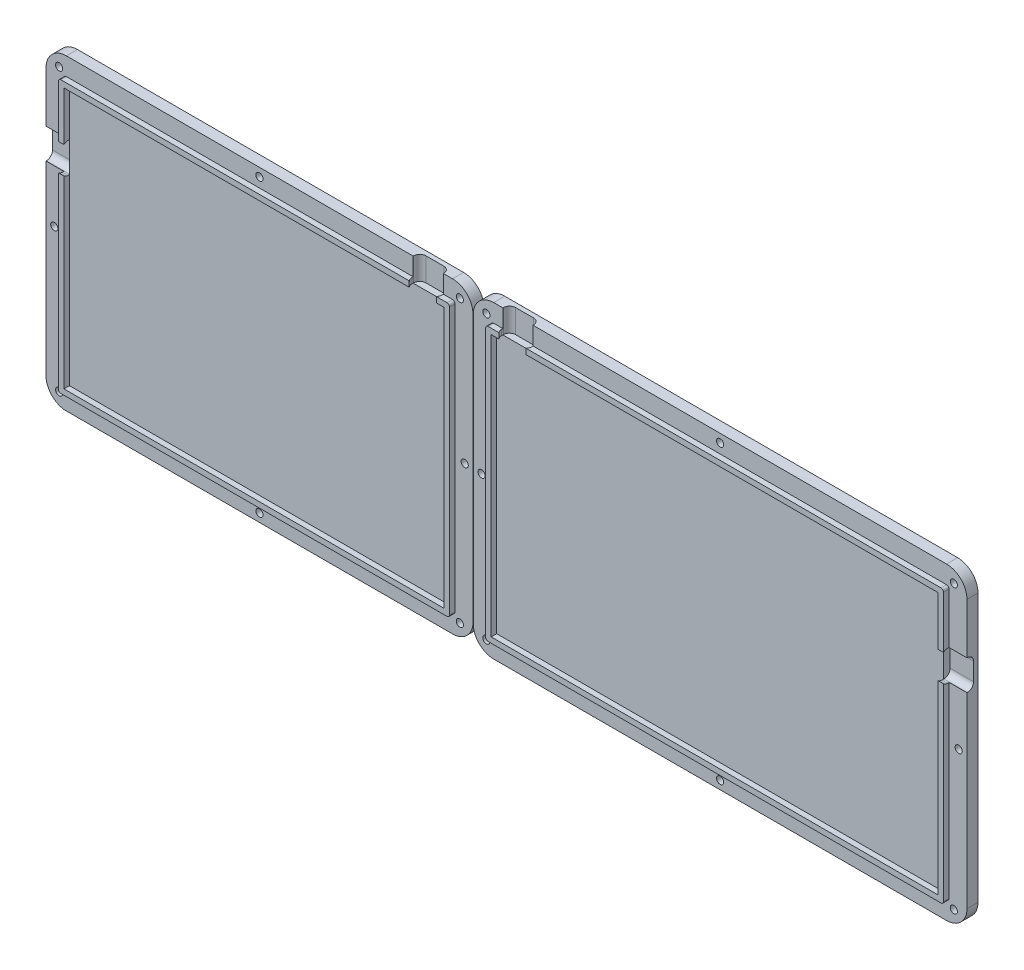
from build123d import *

# Parameters (mm, degrees)
BOSS_EXTRUDE1_DEPTH            = 2
BOSS_EXTRUDE1_2_DEPTH          = 2
BOSS_EXTRUDE2_DEPTH            = 4
BOSS_EXTRUDE2_2_DEPTH          = 4
CUT_EXTRUDE1_DEPTH             = 8.5
CUT_EXTRUDE2_START             = -6.99525
CUT_EXTRUDE2_DEPTH             = 8.5
CUT_EXTRUDE3_START             = -7
CUT_EXTRUDE3_DEPTH             = 8.5
SKETCH7_R                      = 6
SKETCH7_R_2                    = 5.999999998
CUT_EXTRUDE4_DEPTH             = 1
CBORE_FOR_M2_SHCS1_AT_2_COUNT  = 2
CBORE_FOR_M2_SHCS1_AT_2_PITCH  = 169.33925
CBORE_FOR_M2_SHCS1_AT_3_COUNT  = 2
CBORE_FOR_M2_SHCS1_AT_3_PITCH  = 197.865862853
CBORE_FOR_M2_SHCS1_AT_4_COUNT  = 2
CBORE_FOR_M2_SHCS1_AT_4_PITCH  = 102.347999613
CBORE_FOR_M2_SHCS1_AT_5_COUNT  = 2
CBORE_FOR_M2_SHCS1_AT_5_PITCH  = 205.937809117
CBORE_FOR_M2_SHCS1_AT_6_COUNT  = 2
CBORE_FOR_M2_SHCS1_AT_6_PITCH  = 178.95
CBORE_FOR_M2_SHCS1_AT_7_COUNT  = 2
CBORE_FOR_M2_SHCS1_AT_7_PITCH  = 324.12
CBORE_FOR_M2_SHCS1_AT_8_COUNT  = 2
CBORE_FOR_M2_SHCS1_AT_8_PITCH  = 339.76617419
CBORE_FOR_M2_SHCS1_AT_9_COUNT  = 2
CBORE_FOR_M2_SHCS1_AT_9_PITCH  = 84.687729438
CBORE_FOR_M2_SHCS1_AT_10_COUNT = 2
CBORE_FOR_M2_SHCS1_AT_10_PITCH = 178.578567038
CBORE_FOR_M2_SHCS1_AT_11_COUNT = 2
CBORE_FOR_M2_SHCS1_AT_11_PITCH = 272.060490423
CBORE_FOR_M2_SHCS1_AT_12_COUNT = 2
CBORE_FOR_M2_SHCS1_AT_12_PITCH = 251.541084119
CBORE_FOR_M2_SHCS1_AT_13_COUNT = 2
CBORE_FOR_M2_SHCS1_AT_13_PITCH = 329.830375377
CBORE_FOR_M2_SHCS1_AT_14_COUNT = 2
CBORE_FOR_M2_SHCS1_AT_14_PITCH = 51.203914572
CBORE_FOR_M2_SHCS1_AT_15_COUNT = 2
CBORE_FOR_M2_SHCS1_AT_15_PITCH = 134.183962365
CBORE_FOR_M2_SHCS1_AT_16_COUNT = 2
CBORE_FOR_M2_SHCS1_AT_16_PITCH = 184.381831212


# Read off the part's stored shape, not the designer's step: Cut-Extrude2, Cut-Extrude3
with BuildPart() as part:
    # Sketch2 → Boss-Extrude1 (new body)
    with BuildSketch(Plane(origin=(0, 0, 0), x_dir=(-1, 0, 0), z_dir=(0, 0, -1))):
        with BuildLine():
            Line((-127.28, 95.544999648), (-127.28, -1.072999648))
            ThreePointArc((-127.28, -1.072999648), (-127.016396, -1.709396), (-126.379999648, -1.973))
            Line((-126.379999648, -1.973), (13.489999648, -1.973))
            ThreePointArc((13.489999648, -1.973), (14.126396, -1.709396), (14.39, -1.072999648))
            Line((14.39, -1.072999648), (14.39, 65.764999333))
            Line((14.39, 65.764999333), (14.39, 77.705000667))
            Line((14.39, 77.705000667), (14.39, 95.544999648))
            ThreePointArc((14.39, 95.544999648), (14.126396, 96.181396), (13.489999648, 96.445))
            Line((13.489999648, 96.445), (-111.589999333, 96.445))
            Line((-111.589999333, 96.445), (-123.590000667, 96.445))
            Line((-123.590000667, 96.445), (-126.379999648, 96.445))
            ThreePointArc((-126.379999648, 96.445), (-127.016396, 96.181396), (-127.28, 95.544999648))
        make_face()
        Polygon((-125.28, 94.445), (-125.28, 0.027), (12.39, 0.027), (12.39, 65.764999333), (12.39, 77.705000667), (12.39, 94.445), (-111.589999333, 94.445), (-123.590000667, 94.445), align=None, mode=Mode.SUBTRACT)
    extrude(amount=BOSS_EXTRUDE1_DEPTH)


with BuildPart() as body_2:
    # Sketch2 → Boss-Extrude1 2 (new body)
    with BuildSketch(Plane(origin=(0, 0, 0), x_dir=(-1, 0, 0), z_dir=(0, 0, -1))):
        with BuildLine():
            Line((-156.080000667, 96.445), (-305.330002531, 96.445))
            ThreePointArc((-305.330002531, 96.445), (-305.966396812, 96.181397188), (-306.23, 95.545003062))
            Line((-306.23, 95.545003062), (-306.23, 77.705000667))
            Line((-306.23, 77.705000667), (-306.23, 65.764999333))
            Line((-306.23, 65.764999333), (-306.23, -1.503002531))
            ThreePointArc((-306.23, -1.503002531), (-305.966397047, -2.139396422), (-305.330003194, -2.402999469))
            Line((-305.330003194, -2.402999469), (-141.290563258, -2.403023469))
            ThreePointArc((-141.290563258, -2.403023469), (-140.654299585, -2.139474508), (-140.390750531, -1.503210874))
            Line((-140.390750531, -1.503210874), (-140.390750531, 95.545003062))
            ThreePointArc((-140.390750531, 95.545003062), (-140.654353531, 96.181397), (-141.290747469, 96.445))
            Line((-141.290747469, 96.445), (-144.079999333, 96.445))
            Line((-144.079999333, 96.445), (-156.080000667, 96.445))
        make_face()
        Polygon((-156.080000667, 94.445), (-304.23, 94.445), (-304.23, 77.705000667), (-304.23, 65.764999333), (-304.23, -0.40299963), (-142.390750531, -0.403023308), (-142.390750531, 94.445), (-144.079999333, 94.445), align=None, mode=Mode.SUBTRACT)
    extrude(amount=BOSS_EXTRUDE1_2_DEPTH)


with BuildPart() as body_3:
    # Sketch3 → Boss-Extrude2 (new body)
    with BuildSketch(Plane(origin=(0, 0, -2), x_dir=(-1, 0, 0), z_dir=(0, 0, -1))):
        with BuildLine():
            Line((-141.290751305, 102.945), (-144.079999333, 102.945))
            Line((-144.079999333, 102.945), (-305.330002531, 102.945))
            ThreePointArc((-305.330002531, 102.945), (-310.562592434, 100.777589721), (-312.73, 95.544998695))
            Line((-312.73, 95.544998695), (-312.73, -1.503002531))
            ThreePointArc((-312.73, -1.503002531), (-310.562589913, -6.735592243), (-305.329999236, -8.903))
            Line((-305.329999236, -8.903), (-141.291035381, -8.903023979))
            ThreePointArc((-141.291035381, -8.903023979), (-136.05806597, -6.735630109), (-133.890750032, -1.502628421))
            Line((-133.890750032, -1.502628421), (-133.89075, 95.544998695))
            ThreePointArc((-133.89075, 95.544998695), (-136.058158922, 100.777591078), (-141.290751305, 102.945))
        make_face()
    extrude(amount=BOSS_EXTRUDE2_DEPTH)


with BuildPart() as body_4:
    # Sketch3 → Boss-Extrude2 2 (new body)
    with BuildSketch(Plane(origin=(0, 0, -2), x_dir=(-1, 0, 0), z_dir=(0, 0, -1))):
        with BuildLine():
            Line((-133.78, 95.545000824), (-133.78, -1.073000824))
            ThreePointArc((-133.78, -1.073000824), (-131.612590078, -6.305590078), (-126.380000824, -8.473))
            Line((-126.380000824, -8.473), (13.490009317, -8.473))
            ThreePointArc((13.490009317, -8.473), (18.722593496, -6.305586659), (20.89, -1.072999648))
            Line((20.89, -1.072999648), (20.89, 95.545009317))
            ThreePointArc((20.89, 95.545009317), (18.722587075, 100.77759308), (13.490000824, 102.945))
            Line((13.490000824, 102.945), (-123.590000667, 102.945))
            Line((-123.590000667, 102.945), (-126.380009317, 102.945))
            ThreePointArc((-126.380009317, 102.945), (-131.61259308, 100.777587075), (-133.78, 95.545000824))
        make_face()
    extrude(amount=BOSS_EXTRUDE2_2_DEPTH)


with BuildPart() as cut_extrude1_tool:
    # Sketch4 → Cut-Extrude1 (new body)
    with BuildSketch(Plane(origin=(312.73, 0, 0), x_dir=(0, 0, -1), z_dir=(1, 0, 0))):
        with BuildLine():
            Line((1.485, 66.265), (2, 66.265))
            Line((2, 66.265), (2, 77.205))
            Line((2, 77.205), (1.485, 77.205))
            ThreePointArc((1.485, 77.205), (-0.105990258, 76.545990258), (-0.765, 74.955))
            Line((-0.765, 74.955), (-0.765, 73.003244897))
            Line((-0.765, 73.003244897), (-0.765, 71.023244897))
            Line((-0.765, 71.023244897), (-0.765, 68.515))
            ThreePointArc((-0.765, 68.515), (-0.105990258, 66.924009742), (1.485, 66.265))
        make_face()
        with BuildLine():
            ThreePointArc((2.145, 66.265), (3.735990258, 66.924009742), (4.395, 68.515))
            Line((4.395, 68.515), (4.395, 74.955))
            ThreePointArc((4.395, 74.955), (3.735990258, 76.545990258), (2.145, 77.205))
            Line((2.145, 77.205), (2, 77.205))
            Line((2, 77.205), (2, 66.265))
            Line((2, 66.265), (2.145, 66.265))
        make_face()
    extrude(amount=-CUT_EXTRUDE1_DEPTH)


with BuildPart() as body_2_1:
    add(body_2.part)

    # Cut-Extrude1: cut by cut_extrude1_tool
    add(cut_extrude1_tool.part, mode=Mode.SUBTRACT)


with BuildPart() as body_3_1:
    add(body_3.part)

    # Cut-Extrude1: cut by cut_extrude1_tool
    add(cut_extrude1_tool.part, mode=Mode.SUBTRACT)


with BuildPart() as cut_extrude2_tool:
    # Cut-Extrude2 outline → Cut-Extrude2 (new body)
    with BuildSketch(Plane.ZY.offset(19.38525).offset(CUT_EXTRUDE2_START)):
        with BuildLine():
            ThreePointArc((0, 76.645347597), (-0.691520981, 77.060443195), (-1.485, 77.205))
            Line((-1.485, 77.205), (-2.145, 77.205))
            ThreePointArc((-2.145, 77.205), (-3.735990258, 76.545990258), (-4.395, 74.955))
            Line((-4.395, 74.955), (-4.395, 68.515))
            ThreePointArc((-4.395, 68.515), (-3.735990258, 66.924009742), (-2.145, 66.265))
            Line((-2.145, 66.265), (-1.485, 66.265))
            ThreePointArc((-1.485, 66.265), (-0.691520981, 66.409556805), (0, 66.824652403))
            Line((0, 66.824652403), (0, 76.645347597))
        make_face()
    extrude(amount=CUT_EXTRUDE2_DEPTH)


with BuildPart() as part_1:
    add(part.part)

    # Cut-Extrude2: cut by cut_extrude2_tool
    add(cut_extrude2_tool.part, mode=Mode.SUBTRACT)


with BuildPart() as body_4_1:
    add(body_4.part)

    # Cut-Extrude2: cut by cut_extrude2_tool
    add(cut_extrude2_tool.part, mode=Mode.SUBTRACT)


with BuildPart() as cut_extrude3_tool:
    # Cut-Extrude3 outline → Cut-Extrude3 (new body)
    with BuildSketch(Plane(origin=(0, 101.445, 0), x_dir=(1, 0, 0), z_dir=(0, 1, 0)).offset(CUT_EXTRUDE3_START)):
        with BuildLine():
            Line((155.55, 1.485), (155.55, 2.145))
            ThreePointArc((155.55, 2.145), (154.890990258, 3.735990258), (153.3, 4.395))
            Line((153.3, 4.395), (146.86, 4.395))
            ThreePointArc((146.86, 4.395), (145.269009742, 3.735990258), (144.61, 2.145))
            Line((144.61, 2.145), (144.61, 1.485))
            ThreePointArc((144.61, 1.485), (144.754556805, 0.691520981), (145.169652403, 0))
            Line((145.169652403, 0), (154.990347597, 0))
            ThreePointArc((154.990347597, 0), (155.405443195, 0.691520981), (155.55, 1.485))
        make_face()
        with BuildLine():
            ThreePointArc((123.06, 2.145), (122.400990258, 3.735990258), (120.81, 4.395))
            Line((120.81, 4.395), (114.37, 4.395))
            ThreePointArc((114.37, 4.395), (112.779009742, 3.735990258), (112.12, 2.145))
            Line((112.12, 2.145), (112.12, 1.485))
            ThreePointArc((112.12, 1.485), (112.264556805, 0.691520981), (112.679652403, 0))
            Line((112.679652403, 0), (122.500347597, 0))
            ThreePointArc((122.500347597, 0), (122.915443195, 0.691520981), (123.06, 1.485))
            Line((123.06, 1.485), (123.06, 2.145))
        make_face()
    extrude(amount=CUT_EXTRUDE3_DEPTH)


with BuildPart() as part_2:
    add(part_1.part)

    # Cut-Extrude3: cut by cut_extrude3_tool
    add(cut_extrude3_tool.part, mode=Mode.SUBTRACT)


with BuildPart() as body_2_2:
    add(body_2_1.part)

    # Cut-Extrude3: cut by cut_extrude3_tool
    add(cut_extrude3_tool.part, mode=Mode.SUBTRACT)


with BuildPart() as body_3_2:
    add(body_3_1.part)

    # Cut-Extrude3: cut by cut_extrude3_tool
    add(cut_extrude3_tool.part, mode=Mode.SUBTRACT)


with BuildPart() as body_4_2:
    add(body_4_1.part)

    # Cut-Extrude3: cut by cut_extrude3_tool
    add(cut_extrude3_tool.part, mode=Mode.SUBTRACT)


with BuildPart() as cut_extrude4_tool:
    # Sketch7 → Cut-Extrude4 (new body)
    with BuildSketch(Plane(origin=(0, 0, -6), x_dir=(-1, 0, 0), z_dir=(0, 0, -1))):
        with Locations((8.89, 90.945)):
            Circle(SKETCH7_R)
        with Locations((8.89, 3.527)):
            Circle(SKETCH7_R)
        with Locations((-121.78, 90.945)):
            Circle(SKETCH7_R)
        with Locations((-121.78, 3.527)):
            Circle(SKETCH7_R)
        with Locations((-145.89075, 90.945)):
            Circle(SKETCH7_R_2)
        with Locations((-145.89075, 3.096976693)):
            Circle(SKETCH7_R)
        with Locations((-300.73, 90.945)):
            Circle(SKETCH7_R)
        with Locations((-300.73, 3.096999328)):
            Circle(SKETCH7_R)
        with Locations((-223.31039198, 90.945)):
            Circle(SKETCH7_R_2)
        with Locations((-223.310502246, 3.096988011)):
            Circle(SKETCH7_R_2)
        with Locations((-56.444995753, 90.945)):
            Circle(SKETCH7_R)
        with Locations((-56.444995753, 3.527)):
            Circle(SKETCH7_R)
    extrude(amount=-CUT_EXTRUDE4_DEPTH)


with BuildPart() as body_3_3:
    add(body_3_2.part)

    # Cut-Extrude4: cut by cut_extrude4_tool
    add(cut_extrude4_tool.part, mode=Mode.SUBTRACT)

    # Sketch9 → CBORE for M2 SHCS1 (revolve, cut)
    with BuildSketch(Plane(origin=(307.98, 98.195, -6), x_dir=(0, 1, 0), z_dir=(1, 0, 0))):
        Polygon((0, 0), (0, 8), (1.3, 7.218881195), (1.3, 2), (2.2, 2), (2.2, 0), align=None)
    cbore_for_m2_shcs1 = revolve(axis=Axis((307.98, 98.195, -12.35), (0, 0, 1)), mode=Mode.SUBTRACT)

    # CBORE for M2 SHCS1 at 2: CBORE for M2 SHCS1 ×2
    with Locations(*[(-i * CBORE_FOR_M2_SHCS1_AT_2_PITCH, 0, 0) for i in range(1, CBORE_FOR_M2_SHCS1_AT_2_COUNT)]):
        add(cbore_for_m2_shcs1, mode=Mode.SUBTRACT)

    # CBORE for M2 SHCS1 at 3: CBORE for M2 SHCS1 ×2
    with Locations(*[Vector(-0.8558285272557075, -0.5172596368704278, 0) * (i * CBORE_FOR_M2_SHCS1_AT_3_PITCH) for i in range(1, CBORE_FOR_M2_SHCS1_AT_3_COUNT)]):
        add(cbore_for_m2_shcs1, mode=Mode.SUBTRACT)

    # CBORE for M2 SHCS1 at 4: CBORE for M2 SHCS1 ×2
    with Locations(*[(0, -i * CBORE_FOR_M2_SHCS1_AT_4_PITCH, 0) for i in range(1, CBORE_FOR_M2_SHCS1_AT_4_COUNT)]):
        add(cbore_for_m2_shcs1, mode=Mode.SUBTRACT)

    # CBORE for M2 SHCS1 at 9: CBORE for M2 SHCS1 ×2
    with Locations(*[Vector(-0.9997864736420369, 0.020664150658107016, 0) * (i * CBORE_FOR_M2_SHCS1_AT_9_PITCH) for i in range(1, CBORE_FOR_M2_SHCS1_AT_9_COUNT)]):
        add(cbore_for_m2_shcs1, mode=Mode.SUBTRACT)

    # CBORE for M2 SHCS1 at 10: CBORE for M2 SHCS1 ×2
    with Locations(*[Vector(-0.9580615010974515, -0.28656266350468296, 0) * (i * CBORE_FOR_M2_SHCS1_AT_10_PITCH) for i in range(1, CBORE_FOR_M2_SHCS1_AT_10_COUNT)]):
        add(cbore_for_m2_shcs1, mode=Mode.SUBTRACT)

    # CBORE for M2 SHCS1 at 14: CBORE for M2 SHCS1 ×2
    with Locations(*[Vector(0.0341770744412766, -0.9994157931424915, 0) * (i * CBORE_FOR_M2_SHCS1_AT_14_PITCH) for i in range(1, CBORE_FOR_M2_SHCS1_AT_14_COUNT)]):
        add(cbore_for_m2_shcs1, mode=Mode.SUBTRACT)

    # CBORE for M2 SHCS1 at 15: CBORE for M2 SHCS1 ×2
    with Locations(*[Vector(-0.630996354561663, -0.7757857955195443, 0) * (i * CBORE_FOR_M2_SHCS1_AT_15_PITCH) for i in range(1, CBORE_FOR_M2_SHCS1_AT_15_COUNT)]):
        add(cbore_for_m2_shcs1, mode=Mode.SUBTRACT)

    # Combine2: union body 2
    add(body_2_2.part)


with BuildPart() as body_4_3:
    add(body_4_2.part)

    # Cut-Extrude4: cut by cut_extrude4_tool
    add(cut_extrude4_tool.part, mode=Mode.SUBTRACT)

    # CBORE for M2 SHCS1 at 5: CBORE for M2 SHCS1 ×2
    with Locations(*[Vector(-0.8689516547111612, -0.49489698097153, 0) * (i * CBORE_FOR_M2_SHCS1_AT_5_PITCH) for i in range(1, CBORE_FOR_M2_SHCS1_AT_5_COUNT)]):
        add(cbore_for_m2_shcs1, mode=Mode.SUBTRACT)

    # CBORE for M2 SHCS1 at 6: CBORE for M2 SHCS1 ×2
    with Locations(*[(-i * CBORE_FOR_M2_SHCS1_AT_6_PITCH, 0, 0) for i in range(1, CBORE_FOR_M2_SHCS1_AT_6_COUNT)]):
        add(cbore_for_m2_shcs1, mode=Mode.SUBTRACT)

    # CBORE for M2 SHCS1 at 7: CBORE for M2 SHCS1 ×2
    with Locations(*[(-i * CBORE_FOR_M2_SHCS1_AT_7_PITCH, 0, 0) for i in range(1, CBORE_FOR_M2_SHCS1_AT_7_COUNT)]):
        add(cbore_for_m2_shcs1, mode=Mode.SUBTRACT)

    # CBORE for M2 SHCS1 at 8: CBORE for M2 SHCS1 ×2
    with Locations(*[Vector(-0.9539501710913034, -0.29996511643001583, 0) * (i * CBORE_FOR_M2_SHCS1_AT_8_PITCH) for i in range(1, CBORE_FOR_M2_SHCS1_AT_8_COUNT)]):
        add(cbore_for_m2_shcs1, mode=Mode.SUBTRACT)

    # CBORE for M2 SHCS1 at 11: CBORE for M2 SHCS1 ×2
    with Locations(*[Vector(-0.9245554163680936, -0.3810476112829227, 0) * (i * CBORE_FOR_M2_SHCS1_AT_11_PITCH) for i in range(1, CBORE_FOR_M2_SHCS1_AT_11_COUNT)]):
        add(cbore_for_m2_shcs1, mode=Mode.SUBTRACT)

    # CBORE for M2 SHCS1 at 12: CBORE for M2 SHCS1 ×2
    with Locations(*[Vector(-0.9999757989894932, 0.006957114008331568, 0) * (i * CBORE_FOR_M2_SHCS1_AT_12_PITCH) for i in range(1, CBORE_FOR_M2_SHCS1_AT_12_COUNT)]):
        add(cbore_for_m2_shcs1, mode=Mode.SUBTRACT)

    # CBORE for M2 SHCS1 at 13: CBORE for M2 SHCS1 ×2
    with Locations(*[Vector(-0.9879926905698493, -0.15450062582575524, 0) * (i * CBORE_FOR_M2_SHCS1_AT_13_PITCH) for i in range(1, CBORE_FOR_M2_SHCS1_AT_13_COUNT)]):
        add(cbore_for_m2_shcs1, mode=Mode.SUBTRACT)

    # CBORE for M2 SHCS1 at 16: CBORE for M2 SHCS1 ×2
    with Locations(*[Vector(-0.9610491382770345, -0.27637755664483604, 0) * (i * CBORE_FOR_M2_SHCS1_AT_16_PITCH) for i in range(1, CBORE_FOR_M2_SHCS1_AT_16_COUNT)]):
        add(cbore_for_m2_shcs1, mode=Mode.SUBTRACT)

    # Combine1: union part
    add(part_2.part)


solid = Compound([body_3_3.part, body_4_3.part])
